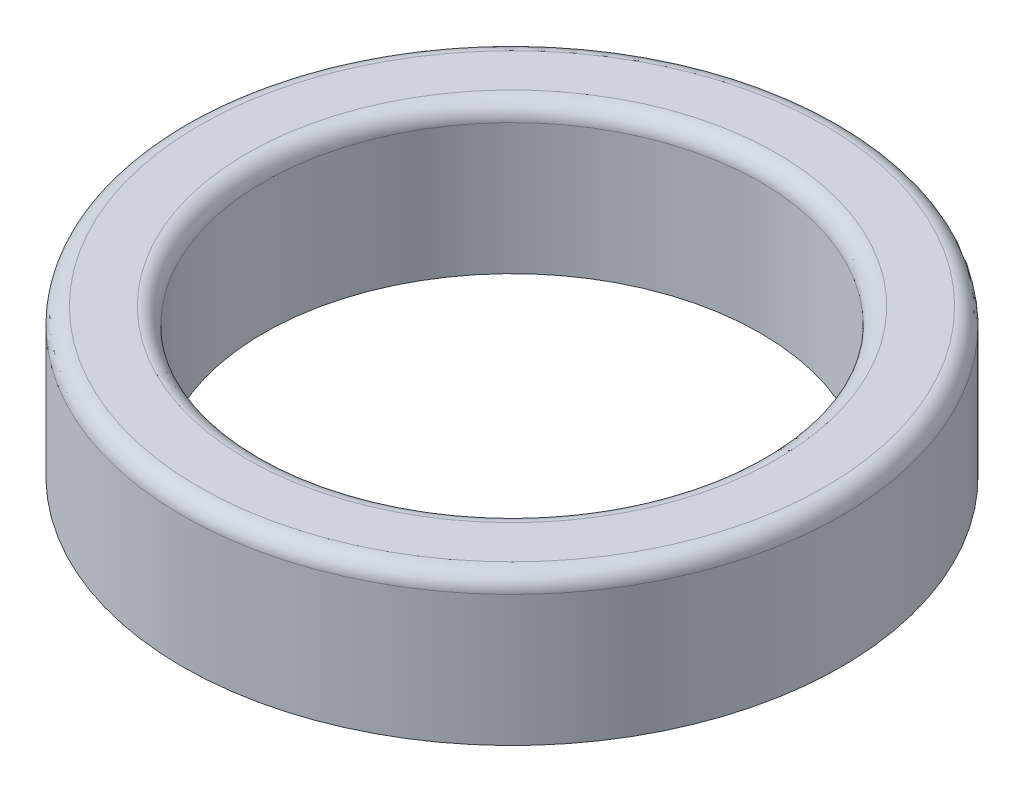
from build123d import *

# Parameters (mm, degrees)
SKETCH1_R           = 19.9
SKETCH1_R_2         = 15
BOSS_EXTRUDE2_DEPTH = 8.9
FILLET1_R           = 1


with BuildPart() as part:
    # Sketch1 → Boss-Extrude2 (new body)
    with BuildSketch(Plane(origin=(0, 0, 0), x_dir=(1, 0, 0), z_dir=(0, 1, 0))):
        Circle(SKETCH1_R)
        Circle(SKETCH1_R_2, mode=Mode.SUBTRACT)
    extrude(amount=BOSS_EXTRUDE2_DEPTH)

    # Fillet1
    fillet1_edges = [part.edges().sort_by_distance(p)[0] for p in [
        (-15, 8.9, 0),
        (-19.9, 8.9, 0),
    ]]
    fillet(fillet1_edges, radius=FILLET1_R)


solid = part.part
